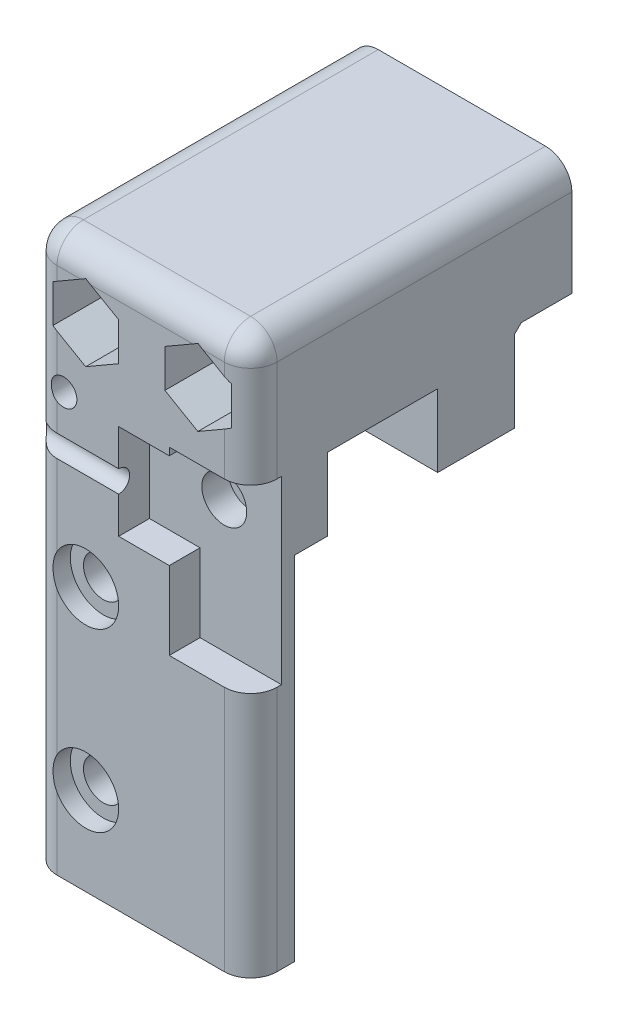
from build123d import *

# Parameters (mm, degrees)
BOSS_EXTRUDE1_DEPTH            = 25
CUT_EXTRUDE1_REACH             = 60.44
SKETCH2_R                      = 2.25
SKETCH3_W                      = 25
SKETCH3_H                      = 63
SKETCH3_R                      = 3.75
BOSS_EXTRUDE2_DEPTH            = 2
FILLET1_R                      = 3
SKETCH4_R                      = 2.55
CUT_EXTRUDE2_DEPTH             = 3.5
SKETCH4_3_R                    = 2.55
CUT_EXTRUDE5_DEPTH             = 6.5
SKETCH6_W                      = 10
SKETCH6_H                      = 1.25
SKETCH5_R                      = 1.5
CUT_EXTRUDE3_DEPTH             = 1
SKETCH5_2_R                    = 1.5
CUT_EXTRUDE4_DEPTH             = 3.75
CUT_EXTRUDE4_DIRECTION_2_REACH = 59.567
CUT_EXTRUDE6_DEPTH             = 10


with BuildPart() as part:
    # Sketch1 → Boss-Extrude1 (new body)
    with BuildSketch(Plane(origin=(0, 0, 0), x_dir=(0, 0, -1), z_dir=(1, 0, 0))):
        Polygon((8.75, 0), (8.75, 9.25), (9.5, 10), (15.25, 10), (15.25, 23), (-19.25, 23), (-19.25, -40), (-16.25, -40), (-16.25, 0), (-12.5, 0), (-12.5, 8.25), (0, 8.25), (0, 0), (3.75, 0), align=None)
    extrude(amount=BOSS_EXTRUDE1_DEPTH)

    # Sketch2 → Cut-Extrude1 (cut, up to next)
    with BuildSketch(Plane.XY.offset(19.25), mode=Mode.PRIVATE) as cut_extrude1_sk1:
        with Locations((6.25, -30)):
            Circle(SKETCH2_R)
    cut_extrude1_tool1 = extrude(cut_extrude1_sk1.sketch, amount=-CUT_EXTRUDE1_REACH, mode=Mode.PRIVATE) & part.part
    # Sketch2 → Cut-Extrude1 (cut, up to next)
    with BuildSketch(Plane.XY.offset(19.25), mode=Mode.PRIVATE) as cut_extrude1_sk2:
        with Locations((6.25, -10)):
            Circle(SKETCH2_R)
    cut_extrude1_tool2 = extrude(cut_extrude1_sk2.sketch, amount=-CUT_EXTRUDE1_REACH, mode=Mode.PRIVATE) & part.part
    # Sketch2 → Cut-Extrude1 (cut, up to next)
    with BuildSketch(Plane.XY.offset(19.25), mode=Mode.PRIVATE) as cut_extrude1_sk3:
        with Locations((6.25, 16)):
            Circle(SKETCH2_R)
    cut_extrude1_tool3 = extrude(cut_extrude1_sk3.sketch, amount=-CUT_EXTRUDE1_REACH, mode=Mode.PRIVATE) & part.part
    # Sketch2 → Cut-Extrude1 (cut, up to next)
    with BuildSketch(Plane.XY.offset(19.25), mode=Mode.PRIVATE) as cut_extrude1_sk4:
        with Locations((19, 16)):
            Circle(SKETCH2_R)
    cut_extrude1_tool4 = extrude(cut_extrude1_sk4.sketch, amount=-CUT_EXTRUDE1_REACH, mode=Mode.PRIVATE) & part.part
    add(cut_extrude1_tool1.solids().sort_by_distance((6.25, -30, 19.25))[0], mode=Mode.SUBTRACT)
    add(cut_extrude1_tool2.solids().sort_by_distance((6.25, -10, 19.25))[0], mode=Mode.SUBTRACT)
    add(cut_extrude1_tool3.solids().sort_by_distance((6.25, 16, 19.25))[0], mode=Mode.SUBTRACT)
    add(cut_extrude1_tool4.solids().sort_by_distance((19, 16, 19.25))[0], mode=Mode.SUBTRACT)

    # Sketch3 → Boss-Extrude2 (add)
    with BuildSketch(Plane.XY.offset(19.25)):
        with Locations((12.5, -8.5)):
            Rectangle(SKETCH3_W, SKETCH3_H)
        with Locations((6.25, -30)):
            Circle(SKETCH3_R, mode=Mode.SUBTRACT)
        with Locations((6.25, -10)):
            Circle(SKETCH3_R, mode=Mode.SUBTRACT)
        Polygon((10, 18.165063509), (6.25, 20.330127019), (2.5, 18.165063509), (2.5, 13.834936491), (6.25, 11.669872981), (10, 13.834936491), align=None, mode=Mode.SUBTRACT)
        Polygon((19, 20.330127019), (15.25, 18.165063509), (15.25, 13.834936491), (19, 11.669872981), (22.75, 13.834936491), (22.75, 18.165063509), align=None, mode=Mode.SUBTRACT)
    extrude(amount=BOSS_EXTRUDE2_DEPTH)

    # Fillet1
    # the kernel refuses this fillet: 3 mm, written as the material it takes off along each edge
    with BuildSketch(Plane(origin=(3, 20, 18.25), x_dir=(0, 0, 1), z_dir=(-1, 0, 0))) as fillet1_piece_1_section:
        Polygon((0, 0), (FILLET1_R, 0), (FILLET1_R, FILLET1_R), (0, FILLET1_R), align=None)
    fillet1_piece_1 = extrude(amount=FILLET1_R, mode=Mode.PRIVATE)
    fillet1_piece_1 = fillet1_piece_1 - Plane(origin=(3, 20, 18.25), x_dir=(0, -0.7071067811865475, -0.7071067811865475), z_dir=(-1, 0, 0)) * Sphere(FILLET1_R, mode=Mode.PRIVATE)
    add(fillet1_piece_1, mode=Mode.SUBTRACT)
    with BuildSketch(Plane(origin=(22, 20, 18.25), x_dir=(0, 0, 1), z_dir=(1, 0, 0))) as fillet1_piece_2_section:
        Polygon((0, 0), (FILLET1_R, 0), (FILLET1_R, -FILLET1_R), (0, -FILLET1_R), align=None)
    fillet1_piece_2 = extrude(amount=FILLET1_R, mode=Mode.PRIVATE)
    fillet1_piece_2 = fillet1_piece_2 - Plane(origin=(22, 20, 18.25), x_dir=(0, -0.7071067811865475, -0.7071067811865475), z_dir=(1, 0, 0)) * Sphere(FILLET1_R, mode=Mode.PRIVATE)
    add(fillet1_piece_2, mode=Mode.SUBTRACT)
    with BuildSketch(Plane(origin=(0, 23, 18.25), x_dir=(1, 0, 0), z_dir=(0, 0, -1))) as fillet1_piece_3:
        with BuildLine():
            CenterArc((FILLET1_R, FILLET1_R), FILLET1_R, 180, 90)
            Line((0, FILLET1_R), (0, 0))
            Line((0, 0), (FILLET1_R, 0))
        make_face()
    extrude(amount=41, mode=Mode.SUBTRACT)
    with BuildSketch(Plane(origin=(25, 23, -22.75), x_dir=(0, -1, 0), z_dir=(0, 0, 1))) as fillet1_piece_4:
        with BuildLine():
            CenterArc((FILLET1_R, -FILLET1_R), FILLET1_R, 90, 90)
            Line((0, -FILLET1_R), (0, 0))
            Line((0, 0), (FILLET1_R, 0))
        make_face()
    extrude(amount=41, mode=Mode.SUBTRACT)
    with BuildSketch(Plane(origin=(22, 23, 21.25), x_dir=(0, -1, 0), z_dir=(-1, 0, 0))) as fillet1_piece_5:
        with BuildLine():
            CenterArc((FILLET1_R, -FILLET1_R), FILLET1_R, 90, 90)
            Line((0, -FILLET1_R), (0, 0))
            Line((0, 0), (FILLET1_R, 0))
        make_face()
    extrude(amount=19, mode=Mode.SUBTRACT)
    with BuildSketch(Plane(origin=(25, -47.5, 21.25), x_dir=(0, 0, -1), z_dir=(0, 1, 0))) as fillet1_piece_6:
        with BuildLine():
            CenterArc((FILLET1_R, FILLET1_R), FILLET1_R, 180, 90)
            Line((0, FILLET1_R), (0, 0))
            Line((0, 0), (FILLET1_R, 0))
        make_face()
    extrude(amount=67.5, mode=Mode.SUBTRACT)
    with BuildSketch(Plane(origin=(0, 20, 21.25), x_dir=(1, 0, 0), z_dir=(0, -1, 0))) as fillet1_piece_7:
        with BuildLine():
            CenterArc((FILLET1_R, -FILLET1_R), FILLET1_R, 90, 90)
            Line((0, -FILLET1_R), (0, 0))
            Line((0, 0), (FILLET1_R, 0))
        make_face()
    extrude(amount=67.5, mode=Mode.SUBTRACT)

    # Sketch4 → Cut-Extrude2 (cut)
    with BuildSketch(Plane.XY.offset(21.25)):
        Polygon((15.75, -12), (25, -12), (25, 8.5), (15.75, 8.5), (15.75, 7.65), (10, 7.65), (10, -3.15), (15.75, -3.15), align=None)
        with Locations((18.5, 3)):
            Circle(SKETCH4_R, mode=Mode.SUBTRACT)
    extrude(amount=-CUT_EXTRUDE2_DEPTH, mode=Mode.SUBTRACT)

    # Sketch4<3> → Cut-Extrude5 (cut)
    with BuildSketch(Plane.XY.offset(21.25)):
        with Locations((18.5, 3)):
            Circle(SKETCH4_3_R)
    extrude(amount=-CUT_EXTRUDE5_DEPTH, mode=Mode.SUBTRACT)

    # Sketch6 → Cut-Revolve1 (revolve, cut)
    with BuildSketch(Plane.XY.offset(21.25)):
        with Locations((5, 2.875)):
            Rectangle(SKETCH6_W, SKETCH6_H)
    revolve(axis=Axis((10, 2.25, 21.25), (-1, 0, 0)), mode=Mode.SUBTRACT)

    # Sketch5 → Cut-Extrude3 (cut, symmetric)
    with BuildSketch(Plane.XY.offset(17.75)):
        Polygon((1, 5.169872981), (6.5, 5.169872981), (6.5, 10.669872981), (1, 10.669872981), (0, 10.669872981), (0, 5.169872981), align=None)
        with Locations((3.75, 7.919872981)):
            Circle(SKETCH5_R, mode=Mode.SUBTRACT)
    extrude(amount=CUT_EXTRUDE3_DEPTH, both=True, mode=Mode.SUBTRACT)

    # Sketch5<2> → Cut-Extrude4 (cut)
    with BuildSketch(Plane.XY.offset(17.75)):
        with Locations(Location((3.75, 7.919872981, 0), (0, 0, 180))):
            Circle(SKETCH5_2_R)
    extrude(amount=-CUT_EXTRUDE4_DEPTH, mode=Mode.SUBTRACT)

    # Sketch5<2> → Cut-Extrude4 direction 2 (cut, up to next)
    with BuildSketch(Plane.XY.offset(17.75), mode=Mode.PRIVATE) as cut_extrude4_direction_2_sk1:
        with Locations(Location((3.75, 7.919872981, 0), (0, 0, 180))):
            Circle(SKETCH5_2_R)
    cut_extrude4_direction_2_tool1 = extrude(cut_extrude4_direction_2_sk1.sketch, amount=CUT_EXTRUDE4_DIRECTION_2_REACH, mode=Mode.PRIVATE) & part.part
    add(cut_extrude4_direction_2_tool1.solids().sort_by_distance((3.75, 7.919873, 17.75))[0], mode=Mode.SUBTRACT)

    # Sketch7 → Cut-Extrude6 (cut)
    with BuildSketch(Plane.XY.offset(19.25)):
        Polygon((22.75, 13.834936491), (22.75, 18.165063509), (19, 20.330127019), (15.25, 18.165063509), (15.25, 13.834936491), (19, 11.669872981), align=None)
        Polygon((6.25, 11.669872981), (10, 13.834936491), (10, 18.165063509), (6.25, 20.330127019), (2.5, 18.165063509), (2.5, 13.834936491), align=None)
    extrude(amount=-CUT_EXTRUDE6_DEPTH, mode=Mode.SUBTRACT)


solid = part.part
